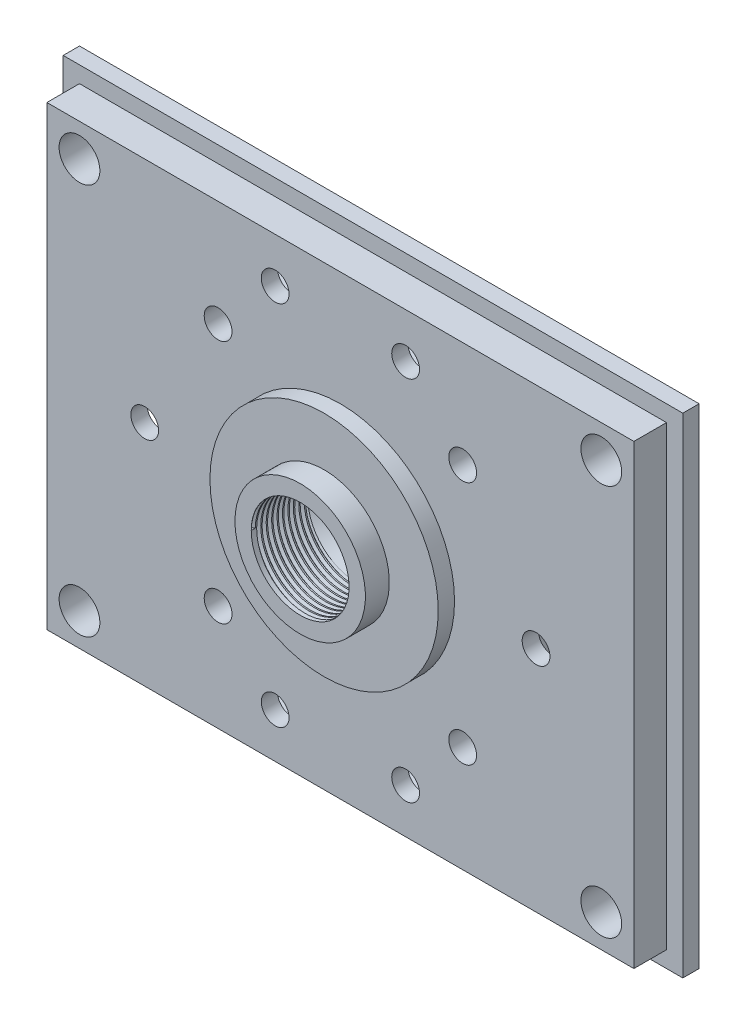
from build123d import *

# Parameters (mm, degrees)
SKETCH1_W               = 120.65
SKETCH1_H               = 95.25
BOSS_EXTRUDE1_DEPTH     = 3.175
CUT_EXTRUDE1_DEPTH      = 79.794658375
CUT_EXTRUDE1_DEPTH_BACK = 79.794658375
SKETCH7_R               = 4.7625
CUT_EXTRUDE2_DEPTH      = 79.794658375
CUT_EXTRUDE2_DEPTH_BACK = 79.794658375
SKETCH21_R              = 3.96875
SKETCH23_W              = 114.3
SKETCH23_H              = 88.9
BOSS_EXTRUDE2_DEPTH     = 6.35
CUT_EXTRUDE3_DEPTH      = 79.15654831
CUT_EXTRUDE3_DEPTH_BACK = 79.15654831
SKETCH24_R              = 3.96875
CUT_EXTRUDE4_DEPTH      = 6.35
SKETCH25_W              = 63.5
SKETCH25_H              = 63.5
BOSS_EXTRUDE3_DEPTH     = 6.35
CUT_EXTRUDE5_DEPTH      = 79.794658375
CUT_EXTRUDE5_DEPTH_BACK = 79.794658375
SKETCH26_R              = 4.7625
THREAD2_PITCH           = 1.058333333
F_1_4_28_TAPPED_HOLE2_D = 5.4102
F_1_4_28_TAPPED_HOLE3_D = 5.4102


with BuildPart() as part:
    # Sketch1 → Boss-Extrude1 (new body)
    with BuildSketch(Plane.XY):
        Rectangle(SKETCH1_W, SKETCH1_H)
    extrude(amount=BOSS_EXTRUDE1_DEPTH)

    # Sketch3 → Revolve1 (revolve)
    with BuildSketch(Plane(origin=(0, 0, 0), x_dir=(1, 0, 0), z_dir=(0, 1, 0))):
        Polygon((-4.7625, -3.175), (-4.7625, 3.175), (-22.225, 3.175), (-22.225, -3.175), (-22.225, -9.525), (-22.225, -12.7), (-12.7, -12.7), (-12.7, -17.359491309), (-9.525, -17.359491309), (-9.525, -6.35), align=None)
    revolve(axis=Axis((0, 0, 0), (0, 0, 1)))

    # Sketch7 → Cut-Extrude1 (cut, two sides: drawn at the far end of the back side and taken through both)
    with BuildSketch(Plane(origin=(0, 0, 0), x_dir=(-1, 0, 0), z_dir=(0, 0, -1)).offset(-CUT_EXTRUDE1_DEPTH_BACK)):
        Circle(SKETCH7_R)
    extrude(amount=CUT_EXTRUDE1_DEPTH + CUT_EXTRUDE1_DEPTH_BACK, mode=Mode.SUBTRACT)

    # Sketch21 → Cut-Extrude2 (cut, two sides: drawn at the far end of the back side and taken through both)
    with BuildSketch(Plane(origin=(0, 0, 0), x_dir=(-1, 0, 0), z_dir=(0, 0, -1)).offset(-CUT_EXTRUDE2_DEPTH_BACK)):
        with Locations(Location((-50.8, -38.1, 0), (0, 0, 180))):
            Circle(SKETCH21_R)
        with Locations(Location((-50.8, 38.1, 0), (0, 0, 180))):
            Circle(SKETCH21_R)
        with Locations(Location((50.8, -38.1, 0), (0, 0, 180))):
            Circle(SKETCH21_R)
        with Locations(Location((50.8, 38.1, 0), (0, 0, 180))):
            Circle(SKETCH21_R)
    extrude(amount=CUT_EXTRUDE2_DEPTH + CUT_EXTRUDE2_DEPTH_BACK, mode=Mode.SUBTRACT)

    # Sketch23 → Boss-Extrude2 (add)
    with BuildSketch(Plane.XY.offset(3.175)):
        Rectangle(SKETCH23_W, SKETCH23_H)
    extrude(amount=BOSS_EXTRUDE2_DEPTH)

    # Sketch24 → Cut-Extrude3 (cut, two sides: drawn at the far end of the back side and taken through both)
    with BuildSketch(Plane(origin=(0, 0, 3.175), x_dir=(-1, 0, 0), z_dir=(0, 0, -1)).offset(-CUT_EXTRUDE3_DEPTH_BACK)):
        with Locations((-50.8, -38.1)):
            Circle(SKETCH24_R)
        with Locations((50.8, -38.1)):
            Circle(SKETCH24_R)
        with Locations((50.8, 38.1)):
            Circle(SKETCH24_R)
        with Locations((-50.8, 38.1)):
            Circle(SKETCH24_R)
    extrude(amount=CUT_EXTRUDE3_DEPTH + CUT_EXTRUDE3_DEPTH_BACK, mode=Mode.SUBTRACT)

    # Sketch22 → Cut-Extrude4 (cut)
    with BuildSketch(Plane(origin=(0, 0, 0), x_dir=(-1, 0, 0), z_dir=(0, 0, -1))):
        Polygon((-50.8, 32.345281703), (-50.8, -32.345281703), (-44.45, -32.345281703), (-44.45, -38.695281703), (44.45, -38.695281703), (44.45, -32.345281703), (50.8, -32.345281703), (50.8, 32.345281703), (44.45, 32.345281703), (44.45, 38.695281703), (-44.45, 38.695281703), (-44.45, 32.345281703), align=None)
    extrude(amount=-CUT_EXTRUDE4_DEPTH, mode=Mode.SUBTRACT)


with BuildPart() as cut_extrude4_piece_1:
    # of the separate pieces the step leaves, piece 1, a body of its own (cut_extrude4_pieces)
    add(part.part.solids().sort_by_distance((-60.325, 47.625, 0))[0])



with BuildPart() as cut_extrude4_piece_2:
    # of the separate pieces the step leaves, piece 2, a body of its own (cut_extrude4_pieces)
    add(part.part.solids().sort_by_distance((-22.225, 0, -3.175))[0])


with BuildPart() as cut_extrude4_piece_1_1:
    add(cut_extrude4_piece_1.part)

    add(cut_extrude4_piece_2.part)  # Boss-Extrude3 merges Cut-Extrude4 piece 2
    # Sketch25 → Boss-Extrude3 (add)
    with BuildSketch(Plane(origin=(0, 0, 6.35), x_dir=(-1, 0, 0), z_dir=(0, 0, -1))):
        Rectangle(SKETCH25_W, SKETCH25_H)
    extrude(amount=BOSS_EXTRUDE3_DEPTH)

    # Sketch26 → Cut-Extrude5 (cut, two sides: drawn at the far end of the back side and taken through both)
    with BuildSketch(Plane(origin=(0, 0, 0), x_dir=(-1, 0, 0), z_dir=(0, 0, -1)).offset(-CUT_EXTRUDE5_DEPTH_BACK)):
        Circle(SKETCH26_R)
    extrude(amount=CUT_EXTRUDE5_DEPTH + CUT_EXTRUDE5_DEPTH_BACK, mode=Mode.SUBTRACT)

    # Sketch27 → Cut-Revolve1 (revolve, cut)
    with BuildSketch(Plane(origin=(0, 0, 0), x_dir=(1, 0, 0), z_dir=(0, 1, 0))):
        Polygon((-4.7625, -3.175), (-9.525, -6.35), (-9.525, -17.359491309), (0, -17.359491309), (0, -3.175), align=None)
    revolve(axis=Axis((0, 0, 0), (0, 0, 1)), mode=Mode.SUBTRACT)

    # Thread2: the profile of Thread Profile2 profile screwed along a right-hand helix of 10.402669 turns, 8 arcs to a turn; built about Z, then put on its axis
    thread2_z = Axis((0, 0, 0), (0, 0, 1))
    thread2_corners = [(9.5247, 0, -0.000173205), (10.097839718, 0, 0.330729166), (10.097839718, 0, 0.463020832), (9.5247, 0, 0.793923202)]
    with BuildLine(mode=Mode.PRIVATE) as thread2_profile:
        Line(thread2_corners[0], thread2_corners[1])
        Line(thread2_corners[1], thread2_corners[2])
        Line(thread2_corners[2], thread2_corners[3])
        Line(thread2_corners[3], thread2_corners[0])
    thread2_cap = Face(thread2_profile.wire())
    thread2_turn_angles = [0, 22.5, 45, 67.5, 90, 112.5, 135, 157.5, 180, 202.5, 225, 247.5, 270, 292.5, 315, 337.5, 360]
    thread2_turn_weights = [1, 0.9238795325112867, 1, 0.9238795325112867, 1, 0.9238795325112867, 1, 0.9238795325112867, 1, 0.9238795325112867, 1, 0.9238795325112867, 1, 0.9238795325112867, 1, 0.9238795325112867, 1]
    thread2_turn_rails = [Edge.make_bspline([Vector(p[0], p[1], 0).rotate(thread2_z, thread2_turn_angles[k]) / thread2_turn_weights[k] + Vector(0, 0, p[2] + THREAD2_PITCH * thread2_turn_angles[k] / 360) for k in range(17)], [0, 0, 0, 1, 1, 2, 2, 3, 3, 4, 4, 5, 5, 6, 6, 7, 7, 8, 8, 8], 2, thread2_turn_weights) for p in thread2_corners]
    thread2_turn_sides = [Face.make_surface_from_curves(thread2_turn_rails[p[0]], thread2_turn_rails[p[1]]) for p in [(0, 1), (1, 2), (2, 3), (3, 0)]]
    thread2_last_angles = [3600, 3622.5, 3645, 3667.5, 3690, 3712.5, 3735, 3739.980411559, 3744.960823118]
    thread2_last_weights = [1, 0.9238795325112867, 1, 0.9238795325112867, 1, 0.9238795325112867, 1, 0.9962244369198905, 1]
    thread2_last_rails = [Edge.make_bspline([Vector(p[0], p[1], 0).rotate(thread2_z, thread2_last_angles[k]) / thread2_last_weights[k] + Vector(0, 0, p[2] + THREAD2_PITCH * thread2_last_angles[k] / 360) for k in range(9)], [0, 0, 0, 1, 1, 2, 2, 3, 3, 4, 4, 4], 2, thread2_last_weights) for p in thread2_corners]
    thread2_last_sides = [Face.make_surface_from_curves(thread2_last_rails[p[0]], thread2_last_rails[p[1]]) for p in [(0, 1), (1, 2), (2, 3), (3, 0)]]
    thread2 = Plane(origin=(0, 0, 17.359491309), x_dir=(-1, 0, 0), z_dir=(0, 0, -1)) * Solid(Shell([*[p.moved(Location((0, 0, THREAD2_PITCH * i))) for i in range(10) for p in thread2_turn_sides], *thread2_last_sides, thread2_cap, thread2_cap.rotate(thread2_z, 3744.960823118).moved(Location((0, 0, THREAD2_PITCH * 3744.960823118 / 360)))]))
    add(thread2, mode=Mode.SUBTRACT)

    # 1/4-28 Tapped Hole2 (through all)
    with Locations(Plane(origin=(0, 0, 0), x_dir=(-1, 0, 0), z_dir=(0, 0, -1))):
        with Locations((-23.8125, 23.8125), (-23.8125, -23.8125), (23.8125, 23.8125), (23.8125, -23.8125)):
            Hole(F_1_4_28_TAPPED_HOLE2_D / 2)

    # 1/4-28 Tapped Hole3 (through all)
    with Locations(Plane(origin=(0, 0, 6.35), x_dir=(-1, 0, 0), z_dir=(0, 0, -1))):
        with Locations((-12.7, 35.71875), (-38.1, 0), (-12.7, -35.71875), (12.7, 35.71875), (38.1, 0), (12.7, -35.71875)):
            Hole(F_1_4_28_TAPPED_HOLE3_D / 2)


solid = cut_extrude4_piece_1_1.part
